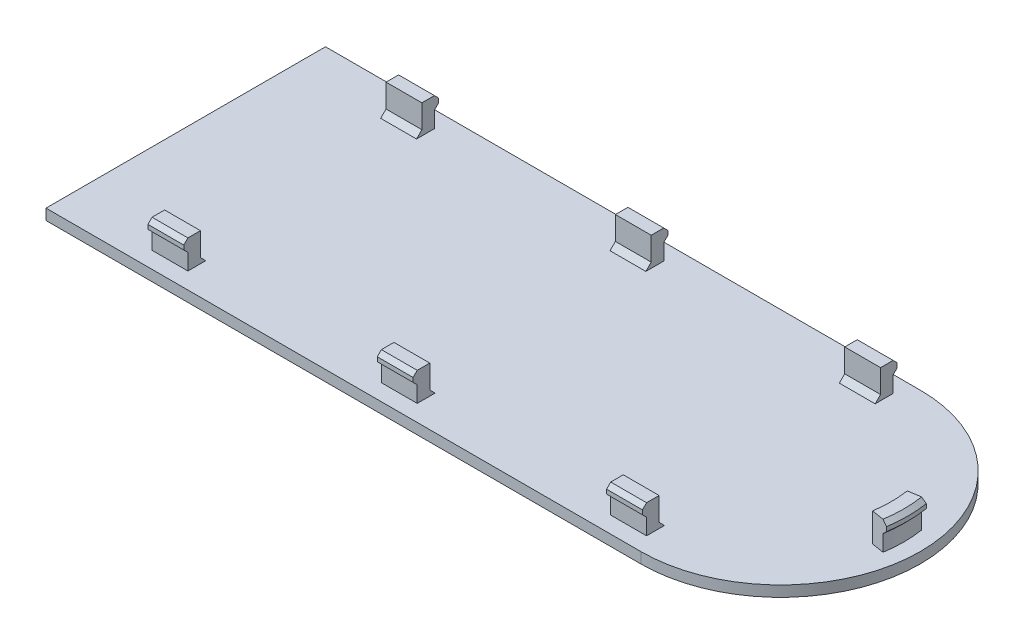
from build123d import *

# Parameters (mm, degrees)
BOSS_EXTRUDE1_DEPTH        = 3
BOSS_EXTRUDE2_DEPTH        = 10
CHAMFER1_SIZE              = 1.5
LPATTERN1_COUNT            = 3
LPATTERN1_PITCH            = 64
CHAMFER1_OF_LPATTERN1_SIZE = 1.5
MIRROR1_START              = -141
MIRROR1_DEPTH              = 10
MIRROR1_START_2            = -77
MIRROR1_2_DEPTH            = 10
MIRROR1_START_3            = -13
MIRROR1_3_DEPTH            = 10
REVOLVE1_ANGLE             = 18


# Read off the part's stored shape, not the designer's step: Mirror1
with BuildPart() as part:
    # Sketch1 → Boss-Extrude1 (new body)
    with BuildSketch(Plane(origin=(0, 0, 0), x_dir=(1, 0, 0), z_dir=(0, 1, 0))):
        with BuildLine():
            Line((0, 39), (-166, 39))
            Line((-166, 39), (-166, -39))
            Line((-166, -39), (0, -39))
            ThreePointArc((0, -39), (39, 0), (0, 39))
        make_face()
    extrude(amount=BOSS_EXTRUDE1_DEPTH)

    # Sketch3 → Boss-Extrude2 (add)
    with BuildSketch(Plane.ZY.offset(141)):
        Polygon((-34.4, 3), (-34.4, 7.5), (-35.55, 8.65), (-35.55, 9.85), (-34.4, 11), (-30.9, 11), (-30.9, 3), align=None)
    boss_extrude2 = extrude(amount=-BOSS_EXTRUDE2_DEPTH)

    # Chamfer1
    chamfer1_edges = [part.edges().sort_by_distance(p)[0] for p in [
        (-136, 3, -30.9),
    ]]
    chamfer(chamfer1_edges, length=CHAMFER1_SIZE)

    # LPattern1: Boss-Extrude2 ×3
    with Locations(*[(i * LPATTERN1_PITCH, 0, 0) for i in range(1, LPATTERN1_COUNT)]):
        add(boss_extrude2)

    # Chamfer1 of LPattern1
    chamfer1_of_lpattern1_edges = [part.edges().sort_by_distance(p)[0] for p in [
        (-72, 3, -30.9),
        (-8, 3, -30.9),
    ]]
    chamfer(chamfer1_of_lpattern1_edges, length=CHAMFER1_OF_LPATTERN1_SIZE)

    # Mirror1 outline → Mirror1 (add)
    with BuildSketch(Plane.YZ.offset(MIRROR1_START)):
        Polygon((11, 30.9), (11, 34.4), (9.85, 35.55), (8.65, 35.55), (7.5, 34.4), (3, 34.4), (3, 29.4), (4.5, 30.9), align=None)
    extrude(amount=MIRROR1_DEPTH)

    # Mirror1 2 outline → Mirror1 2 (add)
    with BuildSketch(Plane.YZ.offset(MIRROR1_START_2)):
        Polygon((11, 30.9), (11, 34.4), (9.85, 35.55), (8.65, 35.55), (7.5, 34.4), (3, 34.4), (3, 29.4), (4.5, 30.9), align=None)
    extrude(amount=MIRROR1_2_DEPTH)

    # Mirror1 3 outline → Mirror1 3 (add)
    with BuildSketch(Plane.YZ.offset(MIRROR1_START_3)):
        Polygon((11, 30.9), (11, 34.4), (9.85, 35.55), (8.65, 35.55), (7.5, 34.4), (3, 34.4), (3, 29.4), (4.5, 30.9), align=None)
    extrude(amount=MIRROR1_3_DEPTH)

    # Sketch4 → Revolve1 (revolve, symmetric)
    with BuildSketch(Plane.XY) as revolve1_sk:
        Polygon((30.9, 11), (30.9, 3), (34.4, 3), (34.4, 7.5), (35.55, 8.65), (35.55, 9.85), (34.4, 11), align=None)
    revolve(axis=Axis((0, 3, 0), (0, -1, 0)), revolution_arc=REVOLVE1_ANGLE / 2)
    revolve(revolve1_sk.sketch, axis=Axis((0, 3, 0), (0, 1, 0)), revolution_arc=REVOLVE1_ANGLE / 2)


solid = part.part
